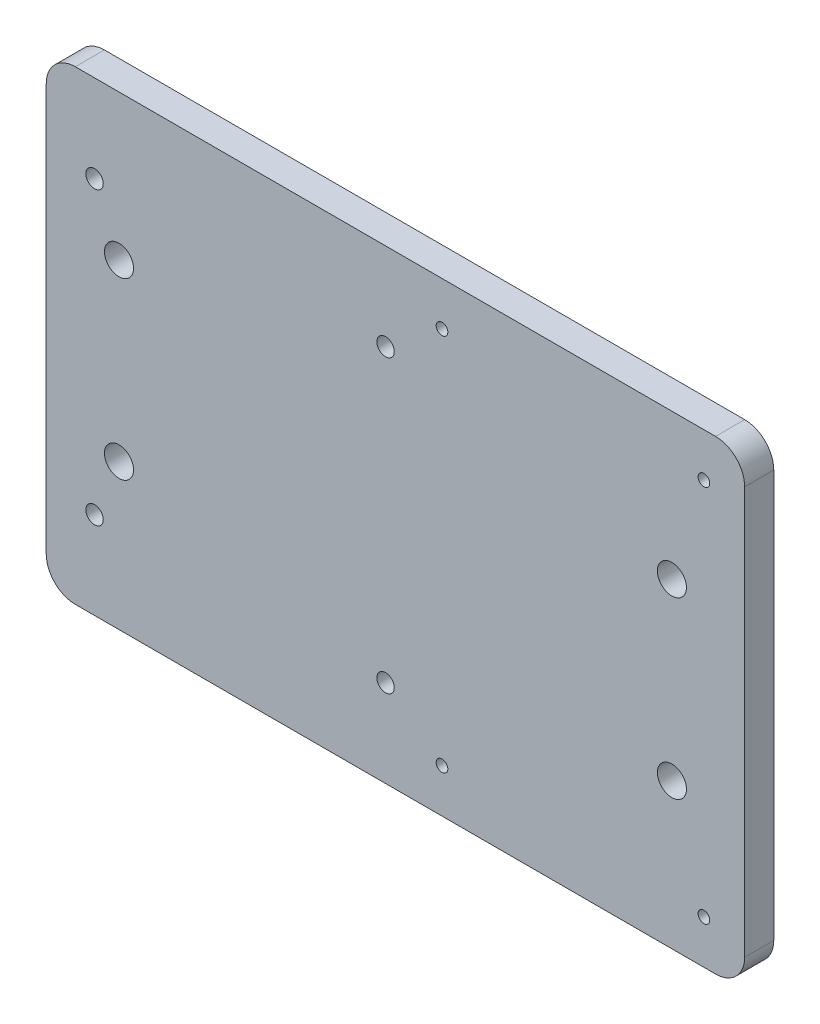
from build123d import *

# Parameters (mm, degrees)
SKETCH_1_W          = 120
SKETCH_1_H          = 80
SKETCH_1_R          = 2.5
EXTRUDE_1_DEPTH     = 5
SKETCH_3_R          = 1.5
SKETCH_3_R_2        = 1
CUT_EXTRUDE_1_DEPTH = 10
FILLET_1_R          = 5


with BuildPart() as part:
    # 草图1 → 凸台-拉伸1 (new body)
    with BuildSketch(Plane.XY):
        Rectangle(SKETCH_1_W, SKETCH_1_H)
        with Locations((-47.5, 15)):
            Circle(SKETCH_1_R, mode=Mode.SUBTRACT)
        with Locations((47.5, 15)):
            Circle(SKETCH_1_R, mode=Mode.SUBTRACT)
        with Locations((47.5, -15)):
            Circle(SKETCH_1_R, mode=Mode.SUBTRACT)
        with Locations((-47.5, -15)):
            Circle(SKETCH_1_R, mode=Mode.SUBTRACT)
    extrude(amount=EXTRUDE_1_DEPTH)

    # 草图3 → 切除-拉伸1 (cut)
    with BuildSketch(Plane(origin=(0, 0, 0), x_dir=(-1, 0, 0), z_dir=(0, 0, -1))):
        with Locations((51.702251253, -25)):
            Circle(SKETCH_3_R)
        with Locations((1.702251253, -25)):
            Circle(SKETCH_3_R)
        with Locations((1.702251253, 25)):
            Circle(SKETCH_3_R)
        with Locations((51.702251253, 25)):
            Circle(SKETCH_3_R)
        with Locations((-8, -32.5)):
            Circle(SKETCH_3_R_2)
        with Locations((-53, -32.5)):
            Circle(SKETCH_3_R_2)
        with Locations((-53, 32.5)):
            Circle(SKETCH_3_R_2)
        with Locations((-8, 32.5)):
            Circle(SKETCH_3_R_2)
    extrude(amount=-CUT_EXTRUDE_1_DEPTH, mode=Mode.SUBTRACT)

    # 圆角1
    fillet_1_edges = [part.edges().sort_by_distance(p)[0] for p in [
        (-60, -40, 2.5),
        (-60, 40, 2.5),
        (60, 40, 2.5),
        (60, -40, 2.5),
    ]]
    fillet(fillet_1_edges, radius=FILLET_1_R)


solid = part.part
